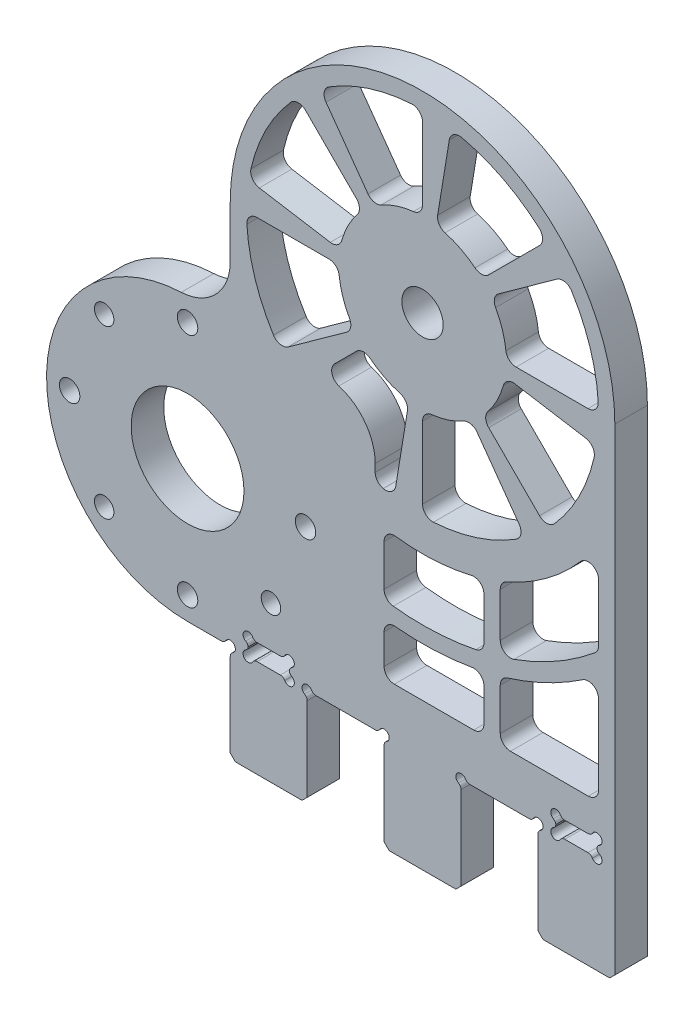
from build123d import *

# Parameters (mm, degrees)
SKETCH1_R                = 11
SKETCH1_R_2              = 4.03
SKETCH1_R_3              = 1.89865
SKETCH1_R_4              = 1.9939
BOSS_EXTRUDE1_DEPTH      = 6.35
SKETCH2_W                = 15
SKETCH2_H                = 19.05
BOSS_EXTRUDE2_DEPTH      = 6.35
CHAMFER1_SIZE            = 1
SKETCH3_R                = 1
CUT_EXTRUDE1_DEPTH       = 159.045298218
FILLET1_R                = 10
FILLET2_R                = 1
SKETCH4_W                = 7.99338
SKETCH4_H                = 3.22072
CUT_EXTRUDE2_DEPTH       = 159.045298363
CUT_EXTRUDE3_DEPTH       = 159.045298363
FILLET4_R                = 2
CIRPATTERN1_COUNT        = 8
FILLET4_OF_CIRPATTERN1_R = 2
BOSS_EXTRUDE3_DEPTH      = 6.35
FILLET6_R                = 2
SKETCH8_R                = 1
CUT_EXTRUDE4_DEPTH       = 159.045298363
FILLET8_R                = 1
CUT_EXTRUDE5_DEPTH       = 159.045298363
FILLET9_R                = 2


with BuildPart() as part:
    # Sketch1 → Boss-Extrude1 (new body)
    with BuildSketch(Plane.XY):
        with BuildLine():
            Line((-40.498784978, 0), (0, 0))
            Line((0, 0), (0, 75))
            ThreePointArc((0, 75), (-37.5, 112.5), (-75, 75))
            Line((-75, 75), (-75, 55))
            Line((-75, 55), (-83.323029145, 55))
            ThreePointArc((-83.323029145, 55), (-110.823029145, 27.5), (-83.323029145, 0))
            Line((-83.323029145, 0), (-40.498784978, 0))
        make_face()
        with Locations((-83.323029145, 27.5)):
            Circle(SKETCH1_R, mode=Mode.SUBTRACT)
        with Locations((-37.5, 75)):
            Circle(SKETCH1_R_2, mode=Mode.SUBTRACT)
        with Locations((-67.059573177, 11.236544033)):
            Circle(SKETCH1_R_3, mode=Mode.SUBTRACT)
        with Locations((-83.323029145, 50.5)):
            Circle(SKETCH1_R_4, mode=Mode.SUBTRACT)
        with Locations((-99.586485112, 11.236544033)):
            Circle(SKETCH1_R_3, mode=Mode.SUBTRACT)
        with Locations((-60.323029145, 27.5)):
            Circle(SKETCH1_R_4, mode=Mode.SUBTRACT)
        with Locations((-99.586485112, 43.763455967)):
            Circle(SKETCH1_R_3, mode=Mode.SUBTRACT)
        with Locations((-83.323029145, 4.5)):
            Circle(SKETCH1_R_4, mode=Mode.SUBTRACT)
        with Locations((-106.323029145, 27.5)):
            Circle(SKETCH1_R_4, mode=Mode.SUBTRACT)
    extrude(amount=BOSS_EXTRUDE1_DEPTH)

    # Sketch2 → Boss-Extrude2 (add)
    with BuildSketch(Plane(origin=(0, 0, 0), x_dir=(-1, 0, 0), z_dir=(0, 0, -1))):
        with Locations((7.5, -9.525)):
            Rectangle(SKETCH2_W, SKETCH2_H)
        with Locations((37.5, -9.525)):
            Rectangle(SKETCH2_W, SKETCH2_H)
        with Locations((67.5, -9.525)):
            Rectangle(SKETCH2_W, SKETCH2_H)
    extrude(amount=-BOSS_EXTRUDE2_DEPTH)

    # Chamfer1
    chamfer1_edges = [part.edges().sort_by_distance(p)[0] for p in [
        (0, -19.05, 3.175),
        (-15, -19.05, 3.175),
        (-30, -19.05, 3.175),
        (-45, -19.05, 3.175),
        (-60, -19.05, 3.175),
        (-75, -19.05, 3.175),
    ]]
    chamfer(chamfer1_edges, length=CHAMFER1_SIZE)

    # Sketch3 → Cut-Extrude1 (cut, through all)
    with BuildSketch(Plane.XY.offset(6.35)):
        with Locations((-75, 0)):
            Circle(SKETCH3_R)
        with Locations((-60, 0)):
            Circle(SKETCH3_R)
        with Locations((-45, 0)):
            Circle(SKETCH3_R)
        with Locations((-30, 0)):
            Circle(SKETCH3_R)
        with Locations((-15, 0)):
            Circle(SKETCH3_R)
    extrude(amount=-CUT_EXTRUDE1_DEPTH, mode=Mode.SUBTRACT)

    # Fillet1
    fillet1_edges = [part.edges().sort_by_distance(p)[0] for p in [
        (-75, 55, 3.175),
    ]]
    fillet(fillet1_edges, radius=FILLET1_R)

    # Fillet2
    fillet2_edges = [part.edges().sort_by_distance(p)[0] for p in [
        (-75, -1, 3.175),
        (-76, 0, 3.175),
        (-60, -1, 3.175),
        (-59, 0, 3.175),
        (-45, -1, 3.175),
        (-46, 0, 3.175),
        (-30, -1, 3.175),
        (-29, 0, 3.175),
        (-15, -1, 3.175),
        (-16, 0, 3.175),
    ]]
    fillet(fillet2_edges, radius=FILLET2_R)

    # Sketch4 → Cut-Extrude2 (cut, through all)
    with BuildSketch(Plane.XY.offset(6.35)):
        with Locations((-67.5, 1.61036)):
            Rectangle(SKETCH4_W, SKETCH4_H)
        with Locations((-7.5, 1.61036)):
            Rectangle(SKETCH4_W, SKETCH4_H)
    extrude(amount=-CUT_EXTRUDE2_DEPTH, mode=Mode.SUBTRACT)

    # Sketch5 → Cut-Extrude3 (cut, through all)
    with BuildSketch(Plane(origin=(0, 0, 0), x_dir=(-1, 0, 0), z_dir=(0, 0, -1))):
        with BuildLine():
            Line((50.778435289, 65.460311521), (65.37659274, 54.972488867))
            ThreePointArc((65.37659274, 54.972488867), (70.173151599, 64.479981483), (71.825, 75))
            Line((71.825, 75), (53.85, 75))
            ThreePointArc((53.85, 75), (53.063176362, 69.989007931), (50.778435289, 65.460311521))
        make_face()
    cut_extrude3 = extrude(amount=-CUT_EXTRUDE3_DEPTH, mode=Mode.SUBTRACT)

    # Fillet4
    fillet4_edges = [part.edges().sort_by_distance(p)[0] for p in [
        (-50.778435289, 65.460311521, 3.175),
        (-53.85, 75, 3.175),
        (-71.825, 75, 3.175),
        (-65.37659274, 54.972488867, 3.175),
    ]]
    fillet(fillet4_edges, radius=FILLET4_R)

    # CirPattern1: Cut-Extrude3 ×8 about axis
    cirpattern1_axis = Axis((-37.5, 75, 0), (0, 0, 1))
    for i in range(1, CIRPATTERN1_COUNT):
        add(cut_extrude3.rotate(cirpattern1_axis, i * 360 / CIRPATTERN1_COUNT), mode=Mode.SUBTRACT)

    # Fillet4 of CirPattern1
    fillet4_of_cirpattern1_edges = [part.edges().sort_by_distance(p)[0] for p in [
        (-40.143693223, 58.86514995, 3.175),
        (-49.061195872, 63.438804128, 3.175),
        (-61.771440264, 50.728559736, 3.175),
        (-43.05013883, 41.126683304, 3.175),
        (-27.960311521, 61.721564711, 3.175),
        (-37.5, 58.65, 3.175),
        (-37.5, 40.675, 3.175),
        (-17.472488867, 47.12340726, 3.175),
        (-21.36514995, 72.356306777, 3.175),
        (-25.938804128, 63.438804128, 3.175),
        (-13.228559736, 50.728559736, 3.175),
        (-3.626683304, 69.44986117, 3.175),
        (-24.221564711, 84.539688479, 3.175),
        (-21.15, 75, 3.175),
        (-3.175, 75, 3.175),
        (-9.62340726, 95.027511133, 3.175),
        (-34.856306777, 91.13485005, 3.175),
        (-25.938804128, 86.561195872, 3.175),
        (-13.228559736, 99.271440264, 3.175),
        (-31.94986117, 108.873316696, 3.175),
        (-47.039688479, 88.278435289, 3.175),
        (-37.5, 91.35, 3.175),
        (-37.5, 109.325, 3.175),
        (-57.527511133, 102.87659274, 3.175),
        (-53.63485005, 77.643693223, 3.175),
        (-49.061195872, 86.561195872, 3.175),
        (-61.771440264, 99.271440264, 3.175),
        (-71.373316696, 80.55013883, 3.175),
    ]]
    fillet(fillet4_of_cirpattern1_edges, radius=FILLET4_OF_CIRPATTERN1_R)

    # Sketch7 → Boss-Extrude3 (add, through all)
    with BuildSketch(Plane(origin=(0, 0, 0), x_dir=(-1, 0, 0), z_dir=(0, 0, -1))):
        with BuildLine():
            Line((56.732050808, 54.972488867), (72.323029145, 54.972488867))
            Line((72.323029145, 54.972488867), (72.323029145, 34.805714709))
            Line((72.323029145, 34.805714709), (46.732050808, 34.805714709))
            Line((46.732050808, 34.805714709), (46.732050808, 44.972488867))
            ThreePointArc((46.732050808, 44.972488867), (49.660982996, 52.043556679), (56.732050808, 54.972488867))
        make_face()
    extrude(amount=-BOSS_EXTRUDE3_DEPTH)

    # Fillet6
    fillet6_edges = [part.edges().sort_by_distance(p)[0] for p in [
        (-57.527511133, 54.972488867, 3.175),
        (-46.732050808, 41.93982966, 3.175),
    ]]
    fillet(fillet6_edges, radius=FILLET6_R)

    # Sketch8 → Cut-Extrude4 (cut, through all)
    with BuildSketch(Plane.XY.offset(6.35)):
        with Locations((-71.49669, 3.22072)):
            Circle(SKETCH8_R)
        with Locations((-63.50331, 3.22072)):
            Circle(SKETCH8_R)
        with Locations((-63.50331, 0)):
            Circle(SKETCH8_R)
        with Locations((-71.49669, 0)):
            Circle(SKETCH8_R)
        with Locations((-11.49669, 3.22072)):
            Circle(SKETCH8_R)
        with Locations((-3.50331, 3.22072)):
            Circle(SKETCH8_R)
        with Locations((-3.50331, 0)):
            Circle(SKETCH8_R)
        with Locations((-11.49669, 0)):
            Circle(SKETCH8_R)
    extrude(amount=-CUT_EXTRUDE4_DEPTH, mode=Mode.SUBTRACT)

    # Fillet8
    # the kernel refuses this fillet: 1 mm, written as the material it takes off along each edge
    with BuildSketch(Plane(origin=(-10.49669, 0, 8.180127019), x_dir=(-0.25881904510251935, -0.9659258262890686, 0), z_dir=(0, 0, -1)), Plane(origin=(-4.50331, 0, -1.830127019), x_dir=(0.2588190451025212, -0.9659258262890682, 0), z_dir=(0, 0, 1)), Plane(origin=(-70.49669, 0, 8.180127019), x_dir=(-0.25881904510253045, -0.9659258262890658, 0), z_dir=(0, 0, -1)), Plane(origin=(-64.50331, 0, -1.830127019), x_dir=(0.2588190451025049, -0.9659258262890725, 0), z_dir=(0, 0, 1))) as fillet8_piece_1:
        with BuildLine():
            CenterArc((0.776457135, -0.965925826), FILLET8_R, 105, 60)
            Line((-0.189468691, -0.707106781), (0, 0))
            ThreePointArc((0, 0), (0.258819045, -0.034074174), (0.51763809, 0))
        make_face()
    extrude(amount=10.010254038, mode=Mode.SUBTRACT)
    with BuildSketch(Plane(origin=(-3.50331, 1, -1.830127019), x_dir=(0.9659258262890684, -0.2588190451025207, 0), z_dir=(0, 0, 1)), Plane(origin=(-4.50331, 3.22072, -1.830127019), x_dir=(0.25881904510252124, 0.9659258262890682, 0), z_dir=(0, 0, 1)), Plane(origin=(-11.49669, 2.22072, -1.830127019), x_dir=(-0.9659258262890682, 0.25881904510252124, 0), z_dir=(0, 0, 1)), Plane(origin=(-71.49669, 2.22072, -1.830127019), x_dir=(-0.9659258262890682, 0.25881904510252124, 0), z_dir=(0, 0, 1)), Plane(origin=(-63.50331, 1, -1.830127019), x_dir=(0.9659258262890688, -0.25881904510251885, 0), z_dir=(0, 0, 1)), Plane(origin=(-64.50331, 3.22072, -1.830127019), x_dir=(0.2588190451025049, 0.9659258262890725, 0), z_dir=(0, 0, 1))) as fillet8_piece_2:
        with BuildLine():
            CenterArc((0.776457135, 0.965925826), FILLET8_R, 195, 60)
            Line((-0.189468691, 0.707106781), (0, 0))
            ThreePointArc((0, 0), (0.258819045, 0.034074174), (0.51763809, 0))
        make_face()
    extrude(amount=10.010254038, mode=Mode.SUBTRACT)
    with BuildSketch(Plane(origin=(-3.50331, 2.22072, -1.830127019), x_dir=(0, -1, 0), z_dir=(0, 0, 1)), Plane(origin=(-11.49669, 1, -1.830127019), x_dir=(0, 1, 0), z_dir=(0, 0, 1)), Plane(origin=(-71.49669, 1, -1.830127019), x_dir=(0, 1, 0), z_dir=(0, 0, 1)), Plane(origin=(-63.50331, 2.22072, -1.830127019), x_dir=(0, -1, 0), z_dir=(0, 0, 1))) as fillet8_piece_3:
        with BuildLine():
            CenterArc((0.732050808, 1), FILLET8_R, 210, 60)
            ThreePointArc((-0.133974596, 0.5), (-0.034074174, 0.258819045), (0, 0))
            Line((0, 0), (0.732050808, 0))
        make_face()
    extrude(amount=10.010254038, mode=Mode.SUBTRACT)
    with BuildSketch(Plane(origin=(-10.49669, 3.22072, 8.180127019), x_dir=(1, 0, 0), z_dir=(0, 0, -1)), Plane(origin=(-70.49669, 3.22072, 8.180127019), x_dir=(1, 0, 0), z_dir=(0, 0, -1))) as fillet8_piece_4:
        with BuildLine():
            CenterArc((0.732050808, -1), FILLET8_R, 90, 60)
            ThreePointArc((-0.133974596, -0.5), (-0.034074174, -0.258819045), (0, 0))
            Line((0, 0), (0.732050808, 0))
        make_face()
    extrude(amount=10.010254038, mode=Mode.SUBTRACT)

    # Sketch9 → Cut-Extrude5 (cut, through all)
    with BuildSketch(Plane(origin=(0, 0, 0), x_dir=(-1, 0, 0), z_dir=(0, 0, -1))):
        with BuildLine():
            Line((22.347579256, 24.544413727), (22.347579256, 37.252685253))
            ThreePointArc((22.347579256, 37.252685253), (11.511569421, 43.71011184), (3.175, 53.176847157))
            Line((3.175, 53.176847157), (3.175, 35.035560613))
            ThreePointArc((3.175, 35.035560613), (12.21127066, 28.78482707), (22.347579256, 24.544413727))
        make_face()
        with BuildLine():
            Line((22.347579256, 9.57072), (22.347579256, 21.237786152))
            ThreePointArc((22.347579256, 21.237786152), (12.290666629, 25.155632182), (3.175, 30.934527494))
            Line((3.175, 30.934527494), (3.175, 9.57072))
            Line((3.175, 9.57072), (22.347579256, 9.57072))
        make_face()
        with BuildLine():
            Line((25.522579256, 9.57072), (25.522579256, 20.4425726))
            ThreePointArc((25.522579256, 20.4425726), (35.226407791, 19.18958636), (45, 19.649105769))
            Line((45, 19.649105769), (45, 9.57072))
            Line((45, 9.57072), (25.522579256, 9.57072))
        make_face()
        with BuildLine():
            Line((25.522579256, 23.6979198), (25.522579256, 36.128454915))
            ThreePointArc((25.522579256, 36.128454915), (35.193998352, 34.390420079), (45, 35.02243598))
            Line((45, 35.02243598), (45, 22.854894376))
            ThreePointArc((45, 22.854894376), (35.221953228, 22.367571371), (25.522579256, 23.6979198))
        make_face()
    extrude(amount=-CUT_EXTRUDE5_DEPTH, mode=Mode.SUBTRACT)

    # Fillet9
    fillet9_edges = [part.edges().sort_by_distance(p)[0] for p in [
        (-22.347579256, 9.57072, 3.175),
        (-3.175, 9.57072, 3.175),
        (-3.175, 30.934527494, 3.175),
        (-22.347579256, 21.237786152, 3.175),
        (-45, 9.57072, 3.175),
        (-25.522579256, 9.57072, 3.175),
        (-25.522579256, 20.4425726, 3.175),
        (-45, 19.649105769, 3.175),
        (-25.522579256, 36.128454915, 3.175),
        (-45, 35.02243598, 3.175),
        (-45, 22.854894376, 3.175),
        (-25.522579256, 23.6979198, 3.175),
        (-3.175, 53.176847157, 3.175),
        (-22.347579256, 37.252685253, 3.175),
        (-22.347579256, 24.544413727, 3.175),
        (-3.175, 35.035560613, 3.175),
    ]]
    fillet(fillet9_edges, radius=FILLET9_R)


solid = part.part
